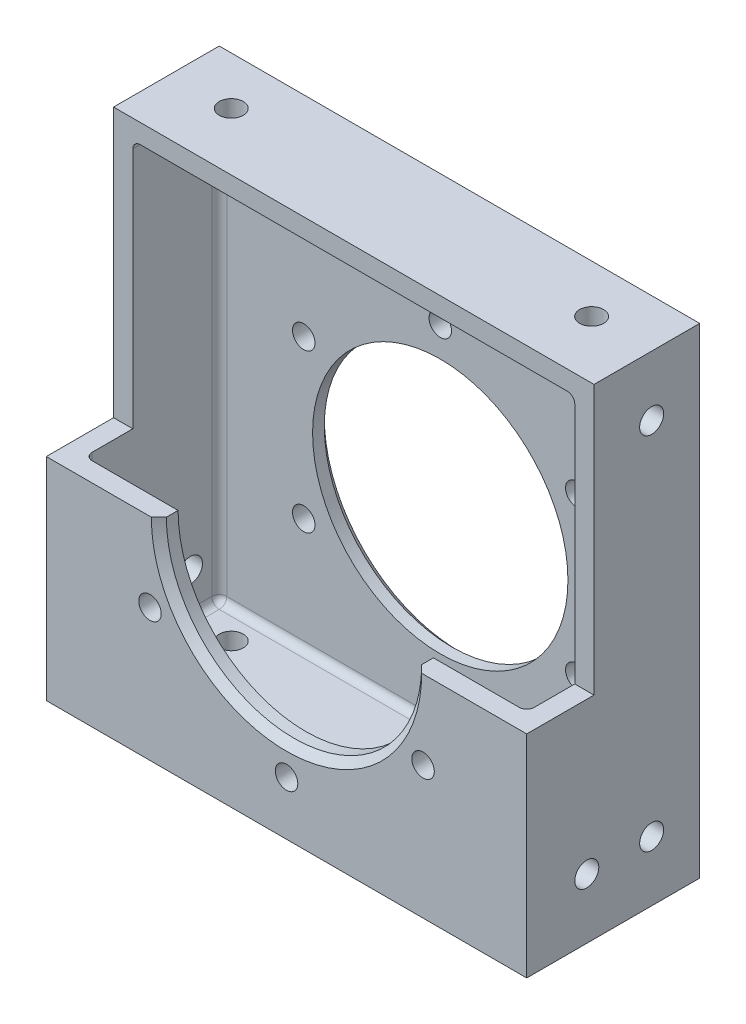
from build123d import *

# Parameters (mm, degrees)
BASE_EXTRUDE_DEPTH = 50.8
SHELL1_T           = -2.032
SKETCH7_R          = 13.5001
CUT_EXTRUDE1_DEPTH = 75.133197314
SKETCH8_R          = 1.27
CUT_EXTRUDE2_DEPTH = 75.133197314
SKETCH9_R          = 1.27
CUT_EXTRUDE3_DEPTH = 75.133197314
SKETCH10_R         = 1.190625
CUT_EXTRUDE4_DEPTH = 75.133197314
CIRPATTERN1_COUNT  = 6
FILLET1_R          = 0.79375
FILLET2_R          = 0.79375
CHAMFER1_SIZE      = 0.79375


with BuildPart() as part:
    # Sketch6 → Base-Extrude (new body)
    with BuildSketch(Plane(origin=(0, 59.342935223, 0), x_dir=(0, 0, -1), z_dir=(1, 0, 0))):
        Polygon((7.112, -8.542935223), (18.288, -8.542935223), (18.288, -59.342935223), (0, -59.342935223), (0, -36.990935223), (7.112, -36.990935223), align=None)
    extrude(amount=-BASE_EXTRUDE_DEPTH)

    # Shell1
    shell1_openings = [part.faces().sort_by_distance(p)[0] for p in [
        (-25.4, 22.352, -3.556),
        (-25.4, 36.576, -7.112),
    ]]
    offset(amount=SHELL1_T, openings=shell1_openings, kind=Kind.INTERSECTION)

    # Sketch7 → Cut-Extrude1 (cut, through all)
    with BuildSketch(Plane.XY):
        with Locations((-25.4, 22.352)):
            Circle(SKETCH7_R)
    extrude(amount=-CUT_EXTRUDE1_DEPTH, mode=Mode.SUBTRACT)

    # Sketch8 → Cut-Extrude2 (cut, through all)
    with BuildSketch(Plane(origin=(0, 0, 0), x_dir=(0, 0, -1), z_dir=(1, 0, 0))):
        with Locations((13.208, 44.45)):
            Circle(SKETCH8_R)
        with Locations((13.208, 6.35)):
            Circle(SKETCH8_R)
        with Locations((6.35, 6.35)):
            Circle(SKETCH8_R)
    extrude(amount=-CUT_EXTRUDE2_DEPTH, mode=Mode.SUBTRACT)

    # Sketch9 → Cut-Extrude3 (cut, through all)
    with BuildSketch(Plane(origin=(0, 50.8, 0), x_dir=(-1, 0, 0), z_dir=(0, 1, 0))):
        with Locations((44.45, -13.208)):
            Circle(SKETCH9_R)
        with Locations((6.35, -13.208)):
            Circle(SKETCH9_R)
    extrude(amount=-CUT_EXTRUDE3_DEPTH, mode=Mode.SUBTRACT)

    # Sketch10 → Cut-Extrude4 (cut, through all)
    with BuildSketch(Plane(origin=(0, 0, -18.288), x_dir=(-1, 0, 0), z_dir=(0, 0, -1))):
        with Locations((25.4, 5.68325)):
            Circle(SKETCH10_R)
    cut_extrude4 = extrude(amount=-CUT_EXTRUDE4_DEPTH, mode=Mode.SUBTRACT)

    # CirPattern1: Cut-Extrude4 ×6 about axis
    cirpattern1_axis = Axis((-25.4, 22.352, -18.288), (0, 0, 1))
    for i in range(1, CIRPATTERN1_COUNT):
        add(cut_extrude4.rotate(cirpattern1_axis, i * 360 / CIRPATTERN1_COUNT), mode=Mode.SUBTRACT)

    # Fillet1
    fillet1_edges = [part.edges().sort_by_distance(p)[0] for p in [
        (-48.768, 25.4, -16.256),
        (-2.032, 25.4, -16.256),
        (-2.032, 12.192, -2.032),
        (-48.768, 12.192, -2.032),
    ]]
    fillet(fillet1_edges, radius=FILLET1_R)

    # Fillet2
    fillet2_edges = [part.edges().sort_by_distance(p)[0] for p in [
        (-25.4, 2.032, -2.032),
        (-48.535516008, 2.032, -2.264483992),
        (-2.264483992, 2.032, -2.264483992),
        (-48.768, 2.032, -9.144),
        (-2.032, 2.032, -9.144),
        (-48.535516008, 2.032, -16.023516008),
        (-2.264483992, 2.032, -16.023516008),
        (-25.4, 2.032, -16.256),
        (-48.768, 48.768, -11.287125),
        (-2.032, 48.768, -11.287125),
        (-48.535516008, 48.768, -16.023516008),
        (-2.264483992, 48.768, -16.023516008),
        (-25.4, 48.768, -16.256),
    ]]
    fillet(fillet2_edges, radius=FILLET2_R)

    # Chamfer1
    chamfer1_edges = [part.edges().sort_by_distance(p)[0] for p in [
        (-25.4, 8.8519, 0),
        (-38.9001, 22.352, -18.288),
    ]]
    chamfer(chamfer1_edges, length=CHAMFER1_SIZE)


solid = part.part
